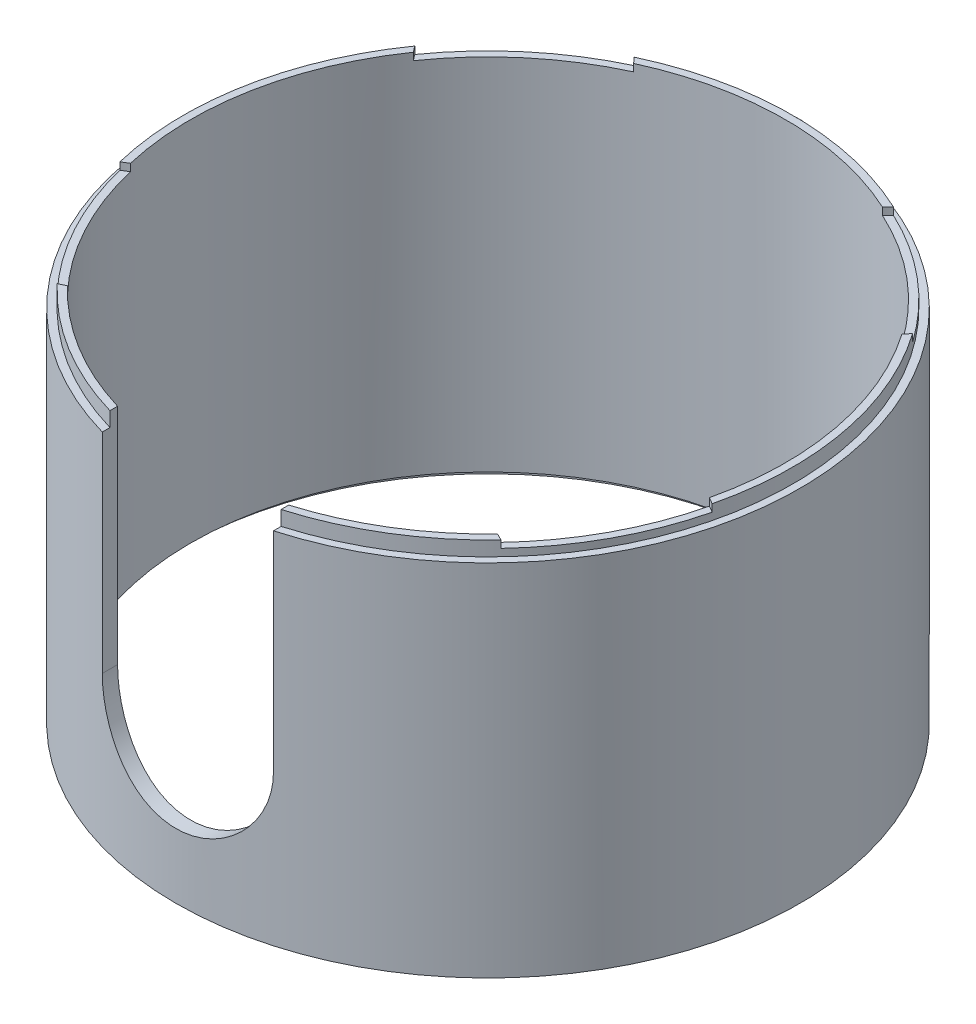
from build123d import *

# Parameters (mm, degrees)
SKETCH2_R           = 42.538
SKETCH2_R_2         = 40.538
BOSS_EXTRUDE1_DEPTH = 51
CUT_EXTRUDE1_DEPTH  = 48
CUT_EXTRUDE3_START  = -1
CUT_EXTRUDE3_DEPTH  = 1
SKETCH29_R          = 10.65
CUT_EXTRUDE16_DEPTH = 1
CUT_EXTRUDE17_START = -2
SKETCH30_R          = 42.538
SKETCH30_R_2        = 41.538
CUT_EXTRUDE17_DEPTH = 2
BOSS_EXTRUDE3_DEPTH = 1
BOSS_EXTRUDE4_START = 1
SKETCH33_R          = 42.538
SKETCH33_R_2        = 41.638
BOSS_EXTRUDE4_DEPTH = 1


# Read off the part's stored shape, not the designer's step: Cut-Extrude3
with BuildPart() as part:
    # Sketch2 → Boss-Extrude1 (new body)
    with BuildSketch(Plane(origin=(0, 0, 0), x_dir=(-1, 0, 0), z_dir=(0, 1, 0))):
        with Locations(Location((-29.391570254, 2.611368154, 0), (0, 0, 90))):
            Circle(SKETCH2_R)
        with Locations(Location((-29.391570254, 2.611368154, 0), (0, 0, 90))):
            Circle(SKETCH2_R_2, mode=Mode.SUBTRACT)
    extrude(amount=BOSS_EXTRUDE1_DEPTH)

    # Sketch3 → Cut-Extrude1 (cut)
    with BuildSketch(Plane.XY):
        with BuildLine():
            Line((17.725570254, 19.5), (17.725570254, 51))
            Line((17.725570254, 51), (41.057570254, 51))
            Line((41.057570254, 51), (41.057570254, 19.5))
            ThreePointArc((41.057570254, 19.5), (29.391570254, 7.834), (17.725570254, 19.5))
        make_face()
    extrude(amount=CUT_EXTRUDE1_DEPTH, mode=Mode.SUBTRACT)

    # Cut-Extrude3 outline → Cut-Extrude3 (cut)
    with BuildSketch(Plane(origin=(0, 51, 0), x_dir=(1, 0, 0), z_dir=(0, 1, 0)).offset(CUT_EXTRUDE3_START)):
        with BuildLine():
            ThreePointArc((41.057570254, -43.518407744), (29.391570254, 39.926631846), (17.725570254, -43.518407744))
            Line((17.725570254, -43.518407744), (17.725570254, -41.434478385))
            ThreePointArc((17.725570254, -41.434478385), (29.391570254, 37.926631846), (41.057570254, -41.434478385))
            Line((41.057570254, -41.434478385), (41.057570254, -43.518407744))
        make_face()
    extrude(amount=CUT_EXTRUDE3_DEPTH, mode=Mode.SUBTRACT)

    # Sketch29 → Cut-Extrude16 (cut)
    with BuildSketch(Plane(origin=(58.783140508, 50, 5.222736308), x_dir=(1, 0, 0), z_dir=(0, 1, 0))):
        with Locations((-54.559325107, 32.628524909)):
            Circle(SKETCH29_R)
        with Locations((-4.223815401, 32.628524909)):
            Circle(SKETCH29_R)
        with Locations((5.046553517, -16.055747722)):
            Circle(SKETCH29_R)
        with Locations((-63.829694025, -16.055747722)):
            Circle(SKETCH29_R)
    extrude(amount=-CUT_EXTRUDE16_DEPTH, mode=Mode.SUBTRACT)

    # Sketch30 → Cut-Extrude17 (cut)
    with BuildSketch(Plane(origin=(0, 50, 0), x_dir=(1, 0, 0), z_dir=(0, 1, 0)).offset(CUT_EXTRUDE17_START)):
        with Locations(Location((29.391570254, -2.611368154, 0), (0, 0, 285.917258926))):
            Circle(SKETCH30_R)
        with Locations((29.391570254, -2.611368154)):
            Circle(SKETCH30_R_2, mode=Mode.SUBTRACT)
    extrude(amount=CUT_EXTRUDE17_DEPTH, mode=Mode.SUBTRACT)

    # Sketch32 → Boss-Extrude3 (add)
    with BuildSketch(Plane(origin=(0, 48, 0), x_dir=(1, 0, 0), z_dir=(0, 1, 0))):
        with BuildLine():
            Line((29.891570254, 38.923622444), (29.891570254, 39.923693196))
            ThreePointArc((29.891570254, 39.923693196), (29.391570254, 39.926631846), (28.891570254, 39.923693196))
            Line((28.891570254, 39.923693196), (28.891570254, 38.923622444))
            ThreePointArc((28.891570254, 38.923622444), (29.391570254, 38.926631846), (29.891570254, 38.923622444))
        make_face()
    extrude(amount=BOSS_EXTRUDE3_DEPTH)

    # Sketch33 → Boss-Extrude4 (add)
    with BuildSketch(Plane.XZ.offset(BOSS_EXTRUDE4_START)):
        with Locations(Location((29.391570254, 2.611368154, 0), (0, 0, 270))):
            Circle(SKETCH33_R)
        with Locations(Location((29.391570254, 2.611368154, 0), (0, 0, 270))):
            Circle(SKETCH33_R_2, mode=Mode.SUBTRACT)
    extrude(amount=-BOSS_EXTRUDE4_DEPTH)


solid = part.part
